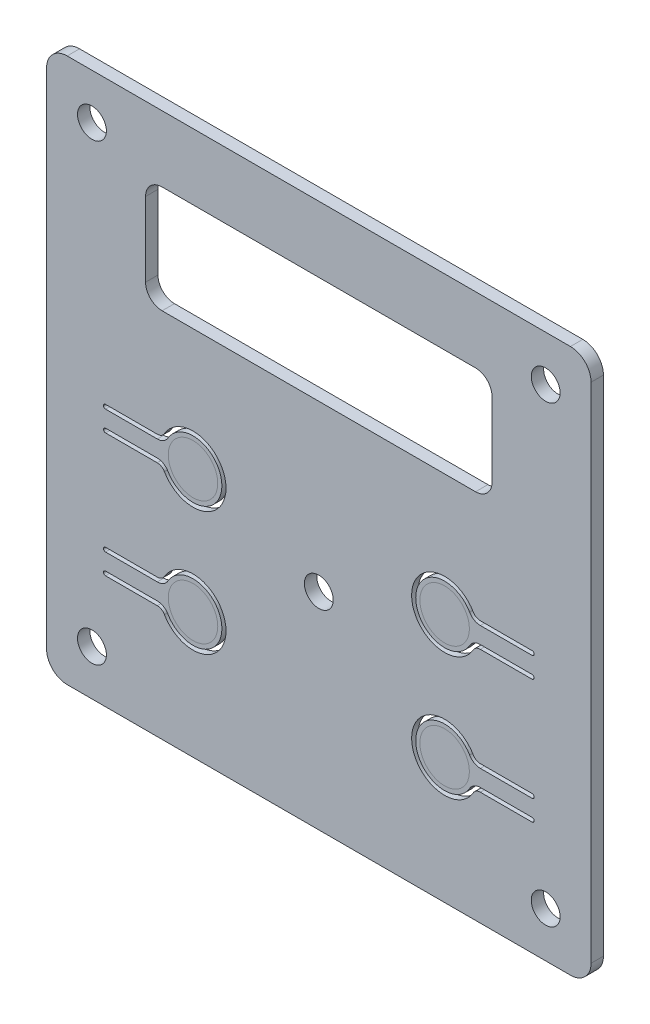
from build123d import *

# Parameters (mm, degrees)
SKETCH_1_W             = 132
SKETCH_1_H             = 132
SKETCH_1_R             = 3.5
EXTRUDE_1_DEPTH        = 3
FILLET_1_R             = 5
CUT_EXTRUDE_1_DEPTH    = 94.386294498
FILLET_2_R             = 0.5
FILLET_2_OF_MIRROR_1_R = 0.5
MIRROR_2_DEPTH         = 3
CUT_EXTRUDE_START      = -1.450001
SKETCH_4_R             = 12.5
CUT_EXTRUDE_2_DEPTH    = 1.450001
CUT_EXTRUDE_3_DEPTH    = 1.449999669
FILLET_3_R             = 1
CUT_EXTRUDE_4_DEPTH    = 94.386294498


# Read off the part's stored shape, not the designer's step: Зеркальное отражение2
# Some blends are built 0.0001 mm under size
with BuildPart() as part:
    # Эскиз1 → Бобышка-Вытянуть1 (new body)
    with BuildSketch(Plane.XY):
        Rectangle(SKETCH_1_W, SKETCH_1_H)
        with Locations((-55, 55)):
            Circle(SKETCH_1_R, mode=Mode.SUBTRACT)
        with Locations((55, 55)):
            Circle(SKETCH_1_R, mode=Mode.SUBTRACT)
        with Locations((55, -55)):
            Circle(SKETCH_1_R, mode=Mode.SUBTRACT)
        with Locations((-55, -55)):
            Circle(SKETCH_1_R, mode=Mode.SUBTRACT)
        with Locations((0, -16)):
            Circle(SKETCH_1_R, mode=Mode.SUBTRACT)
    extrude(amount=EXTRUDE_1_DEPTH)

    # Скругление1
    fillet_1_edges = [part.edges().sort_by_distance(p)[0] for p in [
        (-66, 66, 1.5),
        (66, 66, 1.5),
        (66, -66, 1.5),
        (-66, -66, 1.5),
    ]]
    fillet(fillet_1_edges, radius=FILLET_1_R)

    # Эскиз3 → Вырез-Вытянуть1 (cut, through all)
    with BuildSketch(Plane.XY.offset(3)):
        with BuildLine():
            Line((-39.160131968, -3.499931335), (-52.208081862, -3.499931335))
            Line((-52.208081862, -3.499931335), (-52.208081862, -2.499931335))
            Line((-52.208081862, -2.499931335), (-39.160131968, -2.499931335))
            ThreePointArc((-39.160131968, -2.499931335), (-38.160131968, -2.231982143), (-37.42808116, -1.499931335))
            ThreePointArc((-37.42808116, -1.499931335), (-22.49987793, -5.499931335), (-37.42808116, -9.499931335))
            ThreePointArc((-37.42808116, -9.499931335), (-38.160131968, -8.767880528), (-39.160131968, -8.499931335))
            Line((-39.160131968, -8.499931335), (-52.208081862, -8.499931335))
            Line((-52.208081862, -8.499931335), (-52.208081862, -7.499931335))
            Line((-52.208081862, -7.499931335), (-39.160131968, -7.499931335))
            ThreePointArc((-39.160131968, -7.499931335), (-37.660131968, -7.901855124), (-36.562055756, -8.999931335))
            ThreePointArc((-36.562055756, -8.999931335), (-23.49987793, -5.499931335), (-36.562055756, -1.999931335))
            ThreePointArc((-36.562055756, -1.999931335), (-37.660131968, -3.098007547), (-39.160131968, -3.499931335))
        make_face()
    cut_extrude_1 = extrude(amount=-CUT_EXTRUDE_1_DEPTH, mode=Mode.SUBTRACT)

    # Скругление2
    fillet_2_edges = [part.edges().sort_by_distance(p)[0] for p in [
        (-52.208081862, -7.499931335, 1.5),
        (-52.208081862, -2.499931335, 1.5),
        (-52.208081862, -8.499931335, 1.5),
        (-52.208081862, -3.499931335, 1.5),
    ]]
    fillet(fillet_2_edges, radius=FILLET_2_R - 0.0001)  # a hair under: the kernel refuses the full size

    # Зеркальное отражение1: Вырез-Вытянуть1 across plane
    add(cut_extrude_1.mirror(Plane(origin=(0, 0, 0), x_dir=(0, 0, 1), z_dir=(1, 0, 0))), mode=Mode.SUBTRACT)

    # Скругление2 of Зеркальное отражение1
    fillet_2_of_mirror_1_edges = [part.edges().sort_by_distance(p)[0] for p in [
        (52.208081862, -7.499931335, 1.5),
        (52.208081862, -2.499931335, 1.5),
        (52.208081862, -8.499931335, 1.5),
        (52.208081862, -3.499931335, 1.5),
    ]]
    fillet(fillet_2_of_mirror_1_edges, radius=FILLET_2_OF_MIRROR_1_R - 0.0001)  # a hair under: the kernel refuses the full size

    # Зеркальное отражение2 outline → Зеркальное отражение2 (cut)
    with BuildSketch(Plane.XY):
        with BuildLine():
            ThreePointArc((37.427771906, -39.501176165), (38.159834629, -38.769137272), (39.15983899, -38.501204355))
            Line((39.15983899, -38.501204355), (51.707788883, -38.501408585))
            ThreePointArc((51.707788883, -38.501408585), (52.061344657, -38.354967731), (52.207797021, -38.001416724))
            ThreePointArc((52.207797021, -38.001416724), (52.061356166, -37.647860949), (51.707805159, -37.501408586))
            Line((51.707805159, -37.501408586), (39.159855266, -37.501204356))
            ThreePointArc((39.159855266, -37.501204356), (37.659848724, -37.90310373), (36.561754641, -39.001162069))
            ThreePointArc((36.561754641, -39.001162069), (23.499633782, -35.500949469), (36.561868573, -32.00116207))
            ThreePointArc((36.561868573, -32.00116207), (37.659926912, -33.099256154), (39.15992037, -33.501204356))
            Line((39.15992037, -33.501204356), (51.707870263, -33.501408586))
            ThreePointArc((51.707870263, -33.501408586), (52.061426037, -33.354967731), (52.207878401, -33.001416724))
            ThreePointArc((52.207878401, -33.001416724), (52.061437546, -32.64786095), (51.707886539, -32.501408586))
            Line((51.707886539, -32.501408586), (39.159936646, -32.501204356))
            ThreePointArc((39.159936646, -32.501204356), (38.159941007, -32.233238888), (37.427902114, -31.501176166))
            ThreePointArc((37.427902114, -31.501176166), (22.499633782, -35.500933194), (37.427771906, -39.501176165))
        make_face()
        with BuildLine():
            Line((-51.708374828, -38.499725387), (-39.160424935, -38.499929618))
            ThreePointArc((-39.160424935, -38.499929618), (-38.160429296, -38.767895086), (-37.428390404, -39.499957808))
            ThreePointArc((-37.428390404, -39.499957808), (-22.500122071, -35.50020078), (-37.428260196, -31.499957809))
            ThreePointArc((-37.428260196, -31.499957809), (-38.160322918, -32.231996702), (-39.160327279, -32.499929618))
            Line((-39.160327279, -32.499929618), (-51.708277172, -32.499725388))
            ThreePointArc((-51.708277172, -32.499725388), (-52.061832946, -32.646166243), (-52.20828531, -32.99971725))
            ThreePointArc((-52.20828531, -32.99971725), (-52.061844455, -33.353273024), (-51.708293448, -33.499725388))
            Line((-51.708293448, -33.499725388), (-39.160343555, -33.499929618))
            ThreePointArc((-39.160343555, -33.499929618), (-37.660337014, -33.098030244), (-36.56224293, -31.999971905))
            ThreePointArc((-36.56224293, -31.999971905), (-23.500122071, -35.500184505), (-36.562356862, -38.999971904))
            ThreePointArc((-36.562356862, -38.999971904), (-37.660415201, -37.90187782), (-39.160408659, -37.499929618))
            Line((-39.160408659, -37.499929618), (-51.708358552, -37.499725388))
            ThreePointArc((-51.708358552, -37.499725388), (-52.061914326, -37.646166243), (-52.20836669, -37.99971725))
            ThreePointArc((-52.20836669, -37.99971725), (-52.061925835, -38.353273024), (-51.708374828, -38.499725387))
        make_face()
    extrude(amount=MIRROR_2_DEPTH, mode=Mode.SUBTRACT)

    # Эскиз4 → Вырез-Вытянуть2 (cut)
    with BuildSketch(Plane(origin=(0, 0, 0), x_dir=(-1, 0, 0), z_dir=(0, 0, -1)).offset(CUT_EXTRUDE_START)):
        with Locations((-30.49987793, -5.499931335)):
            Circle(SKETCH_4_R)
        with Locations((30.50012207, -5.499931335)):
            Circle(SKETCH_4_R)
        with Locations((-30.49987793, -35.500070572)):
            Circle(SKETCH_4_R)
        with Locations((30.50012207, -35.500070572)):
            Circle(SKETCH_4_R)
    extrude(amount=CUT_EXTRUDE_2_DEPTH, mode=Mode.SUBTRACT)

    # Эскиз5 → Вырез-Вытянуть3 (cut)
    with BuildSketch(Plane(origin=(0, 0, 0), x_dir=(-1, 0, 0), z_dir=(0, 0, -1))):
        with BuildLine():
            Line((59.424985351, 8.414992237), (59.424985351, -14.445007763))
            ThreePointArc((59.424985351, -14.445007763), (57.674986351, -16.195008762), (55.924985351, -14.445007763))
            Line((55.924985351, -14.445007763), (55.924985351, 8.414992237))
            ThreePointArc((55.924985351, 8.414992237), (57.674985351, 10.164992237), (59.424985351, 8.414992237))
        make_face()
        with BuildLine():
            Line((56.252483478, -31.765923102), (53.712483599, -31.765923102))
            ThreePointArc((53.712483599, -31.765923102), (52.298270037, -32.35170954), (51.712483599, -33.765923102))
            Line((51.712483599, -33.765923102), (51.712483599, -43.925923133))
            ThreePointArc((51.712483599, -43.925923133), (52.298270037, -45.340136695), (53.712483599, -45.925923133))
            Line((53.712483599, -45.925923133), (56.252483478, -45.925923133))
            ThreePointArc((56.252483478, -45.925923133), (57.666697041, -45.340136695), (58.252483478, -43.925923133))
            Line((58.252483478, -43.925923133), (58.252483478, -33.765923102))
            ThreePointArc((58.252483478, -33.765923102), (57.666697041, -32.35170954), (56.252483478, -31.765923102))
        make_face()
        with BuildLine():
            Line((13.924942017, -57.375100136), (8.924942017, -57.375100136))
            ThreePointArc((8.924942017, -57.375100136), (7.174942017, -55.625100136), (8.924942017, -53.875100136))
            Line((8.924942017, -53.875100136), (13.924942017, -53.875100136))
            ThreePointArc((13.924942017, -53.875100136), (15.674942017, -55.625100136), (13.924942017, -57.375100136))
        make_face()
        with BuildLine():
            Line((-2.074954987, -58.825081825), (-4.574954987, -58.825081825))
            ThreePointArc((-4.574954987, -58.825081825), (-6.324954987, -57.075081825), (-4.574954987, -55.325081825))
            Line((-4.574954987, -55.325081825), (-2.074954987, -55.325081825))
            ThreePointArc((-2.074954987, -55.325081825), (-0.324954987, -57.075081825), (-2.074954987, -58.825081825))
        make_face()
        with BuildLine():
            Line((-47.02500206, -33.149315929), (-47.02500206, -40.769315929))
            ThreePointArc((-47.02500206, -40.769315929), (-48.775001727, -42.519316262), (-50.52500206, -40.769315929))
            Line((-50.52500206, -40.769315929), (-50.52500206, -33.149315929))
            ThreePointArc((-50.52500206, -33.149315929), (-48.77500206, -31.399315929), (-47.02500206, -33.149315929))
        make_face()
        with BuildLine():
            Line((-53.130997525, -33.09477642), (-55.670997525, -33.09477642))
            ThreePointArc((-55.670997525, -33.09477642), (-57.420997747, -31.344776642), (-55.670997525, -29.59477642))
            Line((-55.670997525, -29.59477642), (-53.130997525, -29.59477642))
            ThreePointArc((-53.130997525, -29.59477642), (-51.380997525, -31.34477642), (-53.130997525, -33.09477642))
        make_face()
        with BuildLine():
            Line((-11, -11.46), (-13.54, -11.46))
            ThreePointArc((-13.54, -11.46), (-14.954213562, -12.045786438), (-15.54, -13.46))
            Line((-15.54, -13.46), (-15.54, -18.54))
            ThreePointArc((-15.54, -18.54), (-14.954213562, -19.954213562), (-13.54, -20.54))
            Line((-13.54, -20.54), (-11, -20.54))
            ThreePointArc((-11, -20.54), (-9.585786438, -19.954213562), (-9, -18.54))
            Line((-9, -18.54), (-9, -13.46))
            ThreePointArc((-9, -13.46), (-9.585786438, -12.045786438), (-11, -11.46))
        make_face()
        with BuildLine():
            Line((-29.964538037, -17.596759663), (-29.964538037, -20.136759663))
            ThreePointArc((-29.964538037, -20.136759663), (-31.714538007, -21.886759693), (-33.464538037, -20.136759663))
            Line((-33.464538037, -20.136759663), (-33.464538037, -17.596759663))
            ThreePointArc((-33.464538037, -17.596759663), (-31.714538037, -15.846759663), (-29.964538037, -17.596759663))
        make_face()
        with BuildLine():
            Line((-35.210076467, -46.400075757), (-45.370076023, -46.400075757))
            ThreePointArc((-45.370076023, -46.400075757), (-46.784289585, -46.985862194), (-47.370076023, -48.400075757))
            Line((-47.370076023, -48.400075757), (-47.370076023, -50.940077533))
            ThreePointArc((-47.370076023, -50.940077533), (-46.784289585, -52.354291096), (-45.370076023, -52.940077533))
            Line((-45.370076023, -52.940077533), (-35.210076467, -52.940077533))
            ThreePointArc((-35.210076467, -52.940077533), (-33.795862905, -52.354291096), (-33.210076467, -50.940077533))
            Line((-33.210076467, -50.940077533), (-33.210076467, -48.400075757))
            ThreePointArc((-33.210076467, -48.400075757), (-33.795862905, -46.985862194), (-35.210076467, -46.400075757))
        make_face()
        with BuildLine():
            Line((-14.96, -28.25), (-17.5, -28.25))
            ThreePointArc((-17.5, -28.25), (-19.25, -26.5), (-17.5, -24.75))
            Line((-17.5, -24.75), (-14.96, -24.75))
            ThreePointArc((-14.96, -24.75), (-13.21, -26.5), (-14.96, -28.25))
        make_face()
    extrude(amount=-CUT_EXTRUDE_3_DEPTH, mode=Mode.SUBTRACT)

    # Скругление3
    # the kernel refuses this fillet: 1 mm, written as the material it takes off along each edge
    with BuildSketch(Plane(origin=(36.61869211, -46.400075757, -7.64853838), x_dir=(0.8082907926322429, 0.5887834869847663, 0), z_dir=(0, 0, 1))) as fillet_3_piece_1_section:
        with BuildLine():
            CenterArc((3.061680747, -0.993042446), FILLET_3_R, 96.762667507, 137.166604301)
            Line((2.47289726, -1.801333239), (0, 0))
            ThreePointArc((0, 0), (1.471961897, -0.08696942), (2.943923795, 0))
        make_face()
    fillet_3_piece_1 = extrude(amount=16.747076428, mode=Mode.PRIVATE)
    fillet_3_piece_1 = split(fillet_3_piece_1, bisect_by=Plane(origin=(38.145537057, -45.951643098, 1.450001), z_dir=(0, 0, -1)), keep=Keep.TOP, mode=Mode.PRIVATE)
    add(fillet_3_piece_1, mode=Mode.SUBTRACT)
    with BuildSketch(Plane(origin=(33.34755086, -47.671379412, -3.211373049), x_dir=(-0.9841240388917605, -0.17748204437454693, 0), z_dir=(0, 0, 1))) as fillet_3_piece_2_section:
        with BuildLine():
            CenterArc((1.335931188, 0.998679074), FILLET_3_R, 169.776869768, 97.277863338)
            Line((0.351807149, 1.176161119), (0.253394745, 1.193909323))
            ThreePointArc((0.253394745, 1.193909323), (0.166209968, 0.710476558), (-0.085181285, 0.052384622))
            Line((-0.085181285, 0.052384622), (0.005138197, -0.099867907))
            ThreePointArc((0.005138197, -0.099867907), (0.64227461, -0.083488428), (1.279411023, -0.099867907))
            Line((1.279411023, -0.099867907), (1.284549219, 0))
        make_face()
    fillet_3_piece_2 = extrude(amount=7.872745766, mode=Mode.PRIVATE)
    fillet_3_piece_2 = split(fillet_3_piece_2, bisect_by=Plane(origin=(32.872200094, -48.139245926, 1.450001), z_dir=(0, 0, -1)), keep=Keep.TOP, mode=Mode.PRIVATE)
    add(fillet_3_piece_2, mode=Mode.SUBTRACT)
    with BuildSketch(Plane(origin=(29.964538037, -17.988462522, -2.309696046), x_dir=(-0.9969276758889367, 0.07832757526365142, 0), z_dir=(0, 0, 1))) as fillet_3_piece_3:
        with BuildLine():
            CenterArc((0.92456252, 0.99936754), FILLET_3_R, 184.49244117, 83.469685715)
            Line((-0.072365156, 0.921039964), (0, 0))
            ThreePointArc((0, 0), (0.444501211, 0.007905753), (0.889002423, 0))
        make_face()
    extrude(amount=3.759695715, mode=Mode.SUBTRACT)
    with BuildSketch(Plane(origin=(33.464538037, -17.643274798, -1.903409568), x_dir=(0.9640999229669689, 0.26553971178542174, 0), z_dir=(0, 0, 1))) as fillet_3_piece_4:
        with BuildLine():
            CenterArc((0.761927592, -0.999570519), FILLET_3_R, 91.679287926, 72.921687056)
            Line((-0.202172331, -0.734030807), (0, 0))
            ThreePointArc((0, 0), (0.366311342, -0.005368513), (0.732622684, 0))
        make_face()
    extrude(amount=3.353409237, mode=Mode.SUBTRACT)

    # Эскиз6 → Вырез-Вытянуть4 (cut, through all)
    with BuildSketch(Plane.XY.offset(3)):
        with BuildLine():
            Line((38, 50), (-38, 50))
            ThreePointArc((-38, 50), (-40.828427125, 48.828427125), (-42, 46))
            Line((-42, 46), (-42, 28))
            ThreePointArc((-42, 28), (-40.828427125, 25.171572875), (-38, 24))
            Line((-38, 24), (38, 24))
            ThreePointArc((38, 24), (40.828427125, 25.171572875), (42, 28))
            Line((42, 28), (42, 46))
            ThreePointArc((42, 46), (40.828427125, 48.828427125), (38, 50))
        make_face()
    extrude(amount=-CUT_EXTRUDE_4_DEPTH, mode=Mode.SUBTRACT)


solid = part.part
